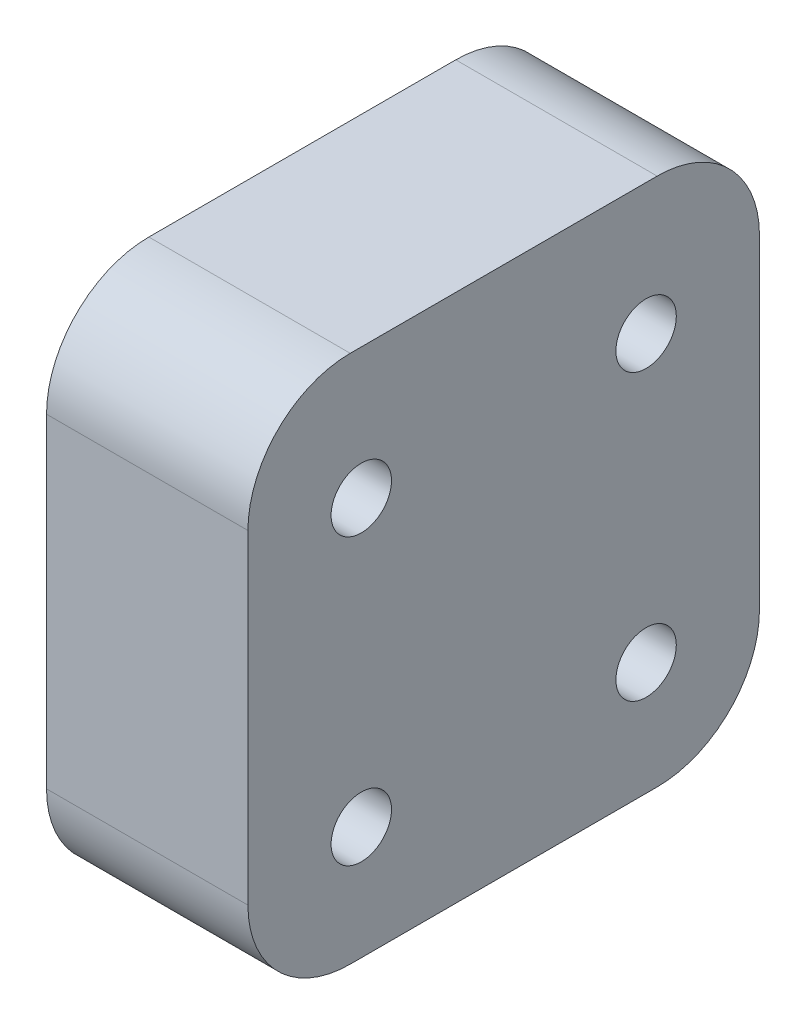
from build123d import *

# Parameters (mm, degrees)
BOSS_EXTRUDE1_DEPTH      = 22.46
BOSS_EXTRUDE1_DEPTH_BACK = 3.81
SKETCH1_W                = 10
SKETCH1_H                = 25.4
SKETCH4_R                = 1.5
CUT_EXTRUDE1_DEPTH       = 6.35
SKETCH5_R                = 1.5
CUT_EXTRUDE2_DEPTH       = 250
SKETCH5_3_R              = 1.5
BOSS_EXTRUDE2_DEPTH      = 6.35
FILLET1_R                = 5.08


with BuildPart() as part:
    # Sketch1 → Boss-Extrude1 (new, two sides: drawn at the far end of the back side and taken through both)
    with BuildSketch(Plane(origin=(0, 0, 0), x_dir=(1, 0, 0), z_dir=(0, 1, 0)).offset(-BOSS_EXTRUDE1_DEPTH_BACK)):
        with Locations((5, 12.7)):
            Rectangle(SKETCH1_W, SKETCH1_H)
    extrude(amount=BOSS_EXTRUDE1_DEPTH + BOSS_EXTRUDE1_DEPTH_BACK)

    # Sketch4 → Cut-Extrude1 (cut)
    with BuildSketch(Plane(origin=(10, 0, 0), x_dir=(0, 0, -1), z_dir=(1, 0, 0))):
        with Locations((19.771067812, 1.818932188)):
            Circle(SKETCH4_R)
        with Locations((5.628932188, 1.818932188)):
            Circle(SKETCH4_R)
        with Locations((5.628932188, 15.961067812)):
            Circle(SKETCH4_R)
        with Locations((19.771067812, 15.961067812)):
            Circle(SKETCH4_R)
    extrude(amount=-CUT_EXTRUDE1_DEPTH, mode=Mode.SUBTRACT)

    # Sketch5 → Cut-Extrude2 (cut)
    with BuildSketch(Plane(origin=(10, 0, 0), x_dir=(0, 0, -1), z_dir=(1, 0, 0))):
        with Locations((13.361067812, 17.551067934)):
            Circle(SKETCH5_R)
        with Locations((3.361067812, 17.551067934)):
            Circle(SKETCH5_R)
        with Locations((3.361067812, 0.231067934)):
            Circle(SKETCH5_R)
        with Locations((13.361067812, 0.231067934)):
            Circle(SKETCH5_R)
    extrude(amount=-CUT_EXTRUDE2_DEPTH, mode=Mode.SUBTRACT)

    # Sketch5<3> → Boss-Extrude2 (add)
    with BuildSketch(Plane(origin=(10, 0, 0), x_dir=(0, 0, -1), z_dir=(1, 0, 0))):
        with Locations((13.361067812, 17.551067934)):
            Circle(SKETCH5_3_R)
        with BuildLine():
            ThreePointArc((4.825860086, 17.227983436), (2.421553774, 18.720389692), (3.361067812, 16.051067934))
            ThreePointArc((3.361067812, 16.051067934), (3.779174595, 16.110517095), (4.164139914, 16.284152309))
            ThreePointArc((4.164139914, 16.284152309), (4.40071946, 16.822167977), (4.825860086, 17.227983436))
        make_face()
        with BuildLine():
            ThreePointArc((4.826405156, 0.551671219), (4.400175744, 0.958608063), (4.163594844, 1.498328903))
            ThreePointArc((4.163594844, 1.498328903), (2.132311367, -0.629256191), (4.826405156, 0.551671219))
        make_face()
        with Locations((13.361067812, 0.231067934)):
            Circle(SKETCH5_3_R)
    extrude(amount=-BOSS_EXTRUDE2_DEPTH)

    # Fillet1
    fillet1_edges = [part.edges().sort_by_distance(p)[0] for p in [
        (5, 22.46, 0),
        (5, 22.46, -25.4),
        (5, -3.81, -25.4),
        (5, -3.81, 0),
    ]]
    fillet(fillet1_edges, radius=FILLET1_R)


solid = part.part
